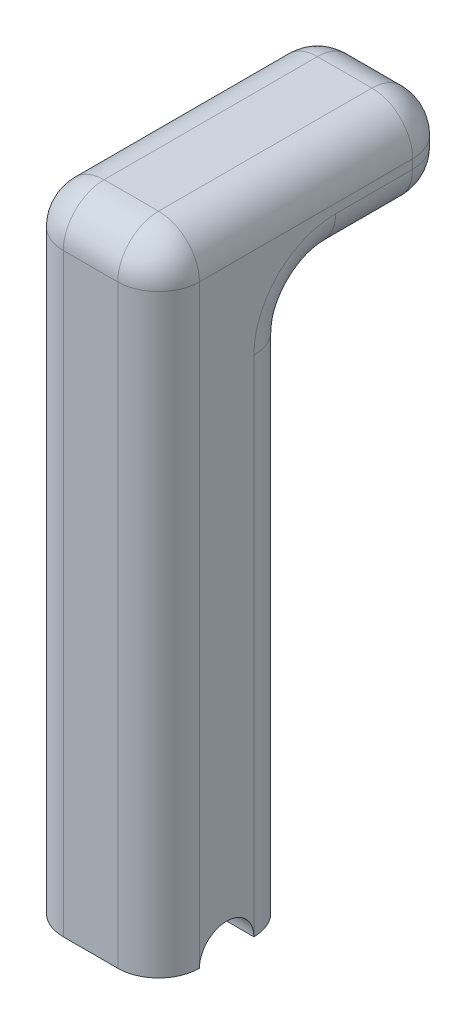
from build123d import *

# Parameters (mm, degrees)
SKETCH1_W           = 150
SKETCH1_H           = 150
BOSS_EXTRUDE1_DEPTH = 700
SKETCH2_W           = 150
SKETCH2_H           = 100
BOSS_EXTRUDE2_DEPTH = 175
FILLET2_R           = 45
CUT_EXTRUDE1_DEPTH  = 735.311748354


with BuildPart() as part:
    # Sketch1 → Boss-Extrude1 (new body)
    with BuildSketch(Plane(origin=(0, 0, 0), x_dir=(1, 0, 0), z_dir=(0, 1, 0))):
        with Locations((-48.820754717, -88.443396226)):
            Rectangle(SKETCH1_W, SKETCH1_H)
    extrude(amount=BOSS_EXTRUDE1_DEPTH)

    # Sketch2 → Boss-Extrude2 (add)
    with BuildSketch(Plane(origin=(0, 0, 13.443396226), x_dir=(-1, 0, 0), z_dir=(0, 0, -1))):
        with Locations((48.820754717, 650)):
            Rectangle(SKETCH2_W, SKETCH2_H)
    extrude(amount=BOSS_EXTRUDE2_DEPTH)

    # Fillet2
    fillet2_edges = [part.edges().sort_by_distance(p)[0] for p in [
        (26.179245283, 300, 13.443396226),
        (-123.820754717, 300, 13.443396226),
        (26.179245283, 700, 0.943396226),
        (-48.820754717, 700, 163.443396226),
        (-123.820754717, 700, 0.943396226),
        (26.179245283, 600, -74.056603774),
        (-123.820754717, 600, -74.056603774),
        (-48.820754717, 600, 13.443396226),
        (-48.820754717, 700, -161.556603774),
        (-123.820754717, 650, -161.556603774),
        (-48.820754717, 600, -161.556603774),
        (26.179245283, 650, -161.556603774),
        (-123.820754717, 350, 163.443396226),
        (26.179245283, 350, 163.443396226),
    ]]
    fillet(fillet2_edges, radius=FILLET2_R)

    # Sketch4 → Cut-Extrude1 (cut, through all)
    with BuildSketch(Plane(origin=(26.179245283, 0, 0), x_dir=(0, 0, -1), z_dir=(1, 0, 0))):
        with BuildLine():
            Line((-118.443396226, 0), (-58.443396226, 0))
            ThreePointArc((-58.443396226, 0), (-88.443396226, 30), (-118.443396226, 0))
        make_face()
    extrude(amount=-CUT_EXTRUDE1_DEPTH, mode=Mode.SUBTRACT)


solid = part.part
